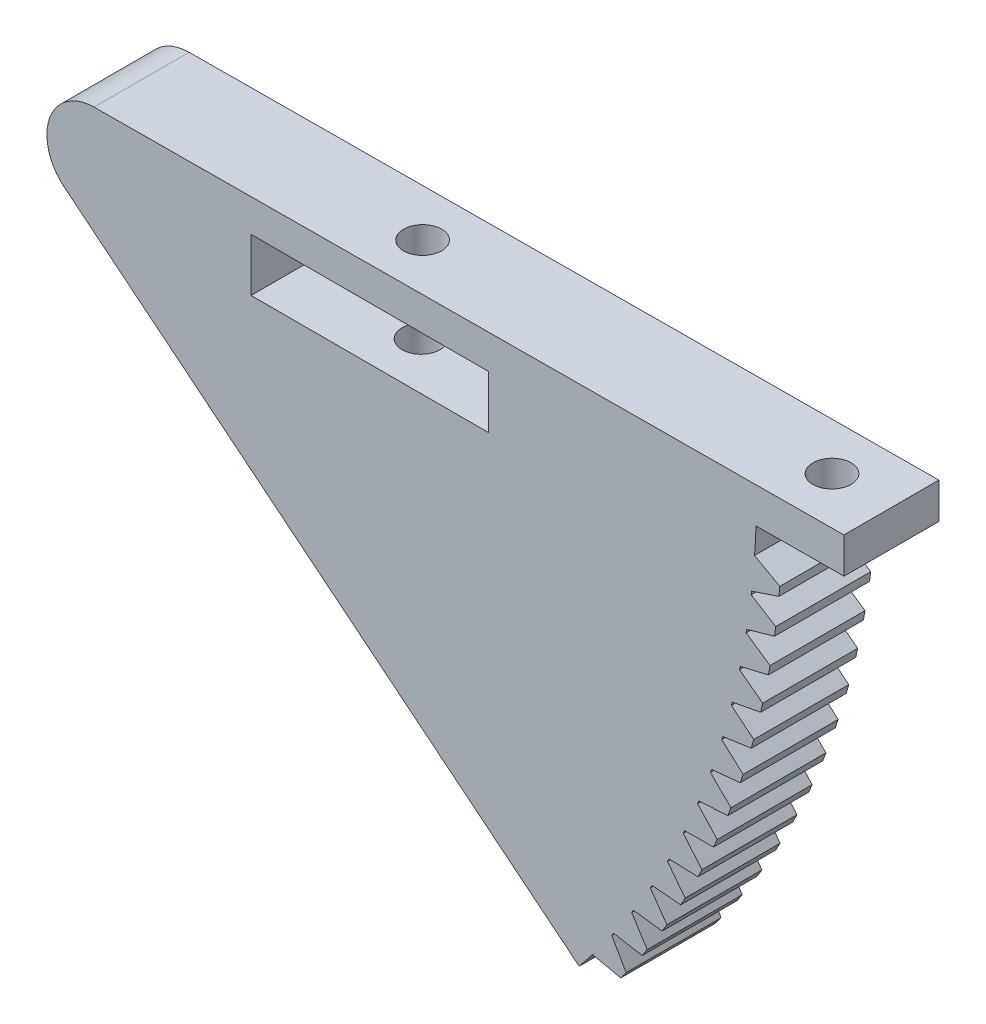
from build123d import *

# Parameters (mm, degrees)
BOSS_EXTRUDE1_DEPTH = 8
SKETCH10_W          = 20
SKETCH10_H          = 4.457955928
CUT_EXTRUDE1_DEPTH  = 8
SKETCH11_R          = 1.6
CUT_EXTRUDE2_DEPTH  = 17
CIRPATTERN1_START   = 27.11938858
CIRPATTERN1_DEPTH   = 8
FILLET1_R           = 4
SKETCH13_R          = 1.6
CUT_EXTRUDE3_DEPTH  = 4


# Read off the part's stored shape, not the designer's step: CirPattern1
with BuildPart() as part:
    # Sketch9 → Boss-Extrude1 (new body)
    with BuildSketch(Plane.XY.offset(35.11938858)):
        with BuildLine():
            Line((9.545521872, 41.744275524), (-57.430180647, 41.351233323))
            Line((-57.430180647, 41.351233323), (-12.111028973, 4.62462141))
            Line((-12.111028973, 4.62462141), (-5.395050947, -0.818002943))
            ThreePointArc((-5.395050947, -0.818002943), (4.336911047, 15.452862836), (9.11951655, 33.798948033))
            Line((9.11951655, 33.798948033), (11.42846507, 34.572240818))
            Line((11.42846507, 34.572240818), (11.499640251, 35.338944212))
            Line((11.499640251, 35.338944212), (9.372495407, 36.524051722))
            ThreePointArc((9.372495407, 36.524051722), (9.443412954, 37.633480095), (9.495906894, 38.743932705))
            Line((9.495906894, 38.743932705), (16.9130003, 38.787459396))
            Line((16.9130003, 38.787459396), (16.895395314, 41.78740774))
            Line((16.895395314, 41.78740774), (9.545521872, 41.744275524))
        make_face()
    extrude(amount=-BOSS_EXTRUDE1_DEPTH)

    # Sketch10 → Cut-Extrude1 (cut)
    with BuildSketch(Plane.XY.offset(35.11938858)):
        with Locations((-23.032343606, 36.517264559)):
            Rectangle(SKETCH10_W, SKETCH10_H)
    extrude(amount=-CUT_EXTRUDE1_DEPTH, mode=Mode.SUBTRACT)

    # Sketch11 → Cut-Extrude2 (cut)
    with BuildSketch(Plane(origin=(0.747199109, 41.914596091, 0), x_dir=(0.9998411421690517, -0.01782387236506677, 0), z_dir=(0.01782387236506677, 0.9998411421690517, 0))):
        with Locations(Location((-23.320690328, -31.11938858, 0), (0, 0, 180))):
            Circle(SKETCH11_R)
    extrude(amount=-CUT_EXTRUDE2_DEPTH, mode=Mode.SUBTRACT)

    # CirPattern1 outline → CirPattern1 (add)
    with BuildSketch(Plane.XY.offset(CIRPATTERN1_START)):
        with BuildLine():
            Line((-1.898240417, 0.075678285), (-1.442349939, 0.696213436))
            Line((-1.442349939, 0.696213436), (-2.655293453, 2.807609427))
            ThreePointArc((-2.655293453, 2.807609427), (-3.454215375, 1.696544027), (-4.275670815, 0.602033397))
            Line((-4.275670815, 0.602033397), (-1.898240417, 0.075678285))
        make_face()
        with BuildLine():
            ThreePointArc((9.087032741, 33.518000709), (8.913106654, 32.160616358), (8.711484025, 30.807068844))
            Line((8.711484025, 30.807068844), (11.052940174, 31.475505904))
            Line((11.052940174, 31.475505904), (11.158600181, 32.238222079))
            Line((11.158600181, 32.238222079), (9.087032741, 33.518000709))
        make_face()
        with BuildLine():
            ThreePointArc((8.666370259, 30.527871164), (8.431440362, 29.179705557), (8.169015006, 27.836621236))
            Line((8.169015006, 27.836621236), (10.538219647, 28.398843937))
            Line((10.538219647, 28.398843937), (10.678149721, 29.156022631))
            Line((10.678149721, 29.156022631), (8.666370259, 30.527871164))
        make_face()
        with BuildLine():
            ThreePointArc((8.11136298, 27.559740684), (7.81590678, 26.223534041), (7.493212091, 24.893642806))
            Line((7.493212091, 24.893642806), (9.885349689, 25.348508399))
            Line((9.885349689, 25.348508399), (10.059265414, 26.098610606))
            Line((10.059265414, 26.098610606), (8.11136298, 27.559740684))
        make_face()
        with BuildLine():
            ThreePointArc((7.423138984, 24.619642155), (7.067757013, 23.298110387), (6.685448884, 21.984115313))
            Line((6.685448884, 21.984115313), (9.095657291, 22.330699261))
            Line((9.095657291, 22.330699261), (9.303205175, 23.072200358))
            Line((9.303205175, 23.072200358), (7.423138984, 24.619642155))
        make_face()
        with BuildLine():
            ThreePointArc((6.603097126, 21.713551487), (6.188511716, 20.409380678), (5.74736721, 19.113952531))
            Line((5.74736721, 19.113952531), (8.170747547, 19.351550382))
            Line((8.170747547, 19.351550382), (8.411505736, 20.082943228))
            Line((8.411505736, 20.082943228), (6.603097126, 21.713551487))
        make_face()
        with BuildLine():
            ThreePointArc((5.652904183, 18.847375463), (5.179958002, 17.563216411), (4.680873768, 16.288988219))
            Line((4.680873768, 16.288988219), (7.112500384, 16.417117043))
            Line((7.112500384, 16.417117043), (7.385979526, 17.136915042))
            Line((7.385979526, 17.136915042), (5.652904183, 18.847375463))
        make_face()
        with BuildLine():
            ThreePointArc((4.574491474, 16.026939742), (4.04414581, 14.76540257), (3.488136265, 13.514964269))
            Line((3.488136265, 13.514964269), (5.923066749, 13.533363638))
            Line((5.923066749, 13.533363638), (6.228710981, 14.240103762))
            Line((6.228710981, 14.240103762), (4.574491474, 16.026939742))
        make_face()
        with BuildLine():
            ThreePointArc((3.370050932, 13.257977012), (2.783383741, 12.021625861), (2.171579003, 10.797519035))
            Line((2.171579003, 10.797519035), (4.604864227, 10.70615155))
            Line((4.604864227, 10.70615155), (4.942052312, 11.398397312))
            Line((4.942052312, 11.398397312), (3.370050932, 13.257977012))
        make_face()
        with BuildLine():
            ThreePointArc((2.042030645, 10.546115336), (1.400234361, 9.337463157), (0.733877956, 8.142175869))
            Line((0.733877956, 8.142175869), (3.160572137, 7.94122724))
            Line((3.160572137, 7.94122724), (3.528618722, 8.617571614))
            Line((3.528618722, 8.617571614), (2.042030645, 10.546115336))
        make_face()
        with BuildLine():
            ThreePointArc((0.593129889, 7.896866722), (-0.102491005, 6.718370166), (-0.82204467, 5.554331901))
            Line((-0.82204467, 5.554331901), (1.593126081, 5.244210567))
            Line((1.593126081, 5.244210567), (1.991283091, 5.903278845))
            Line((1.991283091, 5.903278845), (0.593129889, 7.896866722))
        make_face()
        with BuildLine():
            ThreePointArc((-0.973706371, 5.315615908), (-1.721737986, 4.169670332), (-2.493026381, 3.039247062))
            Line((-2.493026381, 3.039247062), (-0.094288024, 2.620583361))
            Line((-0.094288024, 2.620583361), (0.333170136, 3.261035952))
            Line((0.333170136, 3.261035952), (-0.973706371, 5.315615908))
        make_face()
    extrude(amount=CIRPATTERN1_DEPTH)

    # Fillet1
    fillet1_edges = [part.edges().sort_by_distance(p)[0] for p in [
        (-57.430180647, 41.351233323, 31.11938858),
    ]]
    fillet(fillet1_edges, radius=FILLET1_R)

    # Sketch13 → Cut-Extrude3 (cut)
    with BuildSketch(Plane(origin=(-0.244636188, 41.68682267, 0), x_dir=(0.9999827812112165, 0.005868328644527354, 0), z_dir=(-0.005868328644527354, 0.9999827812112165, 0))):
        with Locations(Location((12.140326638, -31.11938858, 0), (0, 0, 180))):
            Circle(SKETCH13_R)
    extrude(amount=-CUT_EXTRUDE3_DEPTH, mode=Mode.SUBTRACT)


solid = part.part
